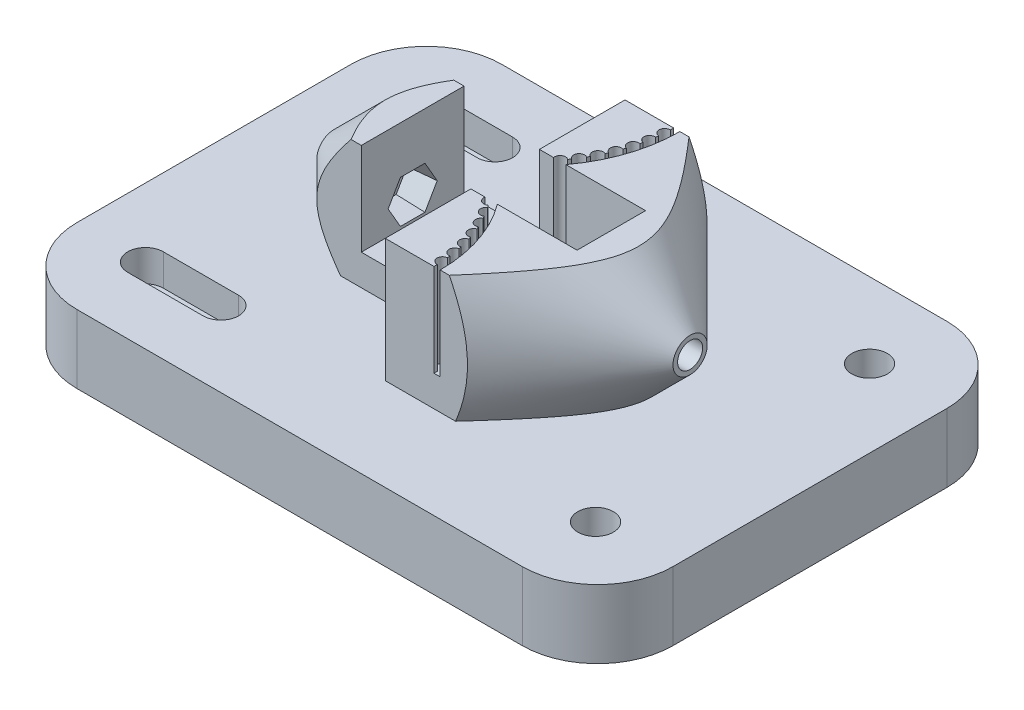
from build123d import *

# Parameters (mm, degrees)
BOSS_EXTRUDE1_DEPTH  = 10
BOSS_EXTRUDE3_DEPTH  = 18
CUT_EXTRUDE1_DEPTH   = 13.5
CUT_EXTRUDE11_DEPTH  = 13.5
SKETCH18_R           = 0.8
CUT_EXTRUDE12_DEPTH  = 13.5
CUT_EXTRUDE5_REACH   = 110.337
SKETCH8_R            = 2.6
SKETCH9_R            = 4.1
CUT_EXTRUDE6_DEPTH   = 5.4
CUT_EXTRUDE7_REACH   = 112.44
SKETCH11_R           = 1.6
CUT_EXTRUDE8_DEPTH   = 3
SKETCH13_W           = 19.1
SKETCH13_H           = 8.2
SKETCH13_W_2         = 8.2
BOSS_EXTRUDE4_DEPTH  = 0.3
CUT_EXTRUDE9_REACH   = 99.254
SKETCH14_R           = 1.825
CUT_EXTRUDE10_DEPTH  = 4
CUT_EXTRUDE10_DRAFT  = -5
MIRROR1_COPY_1_DEPTH = 4
MIRROR1_COPY_1_DRAFT = -5


with BuildPart() as part:
    # Sketch1 → Boss-Extrude1 (new body)
    with BuildSketch(Plane(origin=(0, 0, 0), x_dir=(1, 0, 0), z_dir=(0, 1, 0))):
        with BuildLine():
            Line((0, 11), (0, 51))
            ThreePointArc((0, 51), (3.221825407, 58.778174593), (11, 62))
            Line((11, 62), (76, 62))
            ThreePointArc((76, 62), (83.778174593, 58.778174593), (87, 51))
            Line((87, 51), (87, 11))
            ThreePointArc((87, 11), (83.778174593, 3.221825407), (76, 0))
            Line((76, 0), (11, 0))
            ThreePointArc((11, 0), (3.221825407, 3.221825407), (0, 11))
        make_face()
    extrude(amount=BOSS_EXTRUDE1_DEPTH)


with BuildPart() as body_2:
    # Sketch2 → Boss-Extrude3 (new body)
    with BuildSketch(Plane(origin=(0, 10, 0), x_dir=(1, 0, 0), z_dir=(0, 1, 0))):
        Polygon((17.5, 38.5), (42.5, 38.5), (42.5, 48.5), (57.5, 48.5), (67.5, 38.5), (69.5, 38.5), (69.5, 23.5), (67.5, 23.5), (57.5, 13.5), (42.5, 13.5), (42.5, 23.5), (17.5, 23.5), align=None)
    extrude(amount=BOSS_EXTRUDE3_DEPTH)

    # Sketch3 → Cut-Revolve3 (revolve, cut)
    with BuildSketch(Plane.XY.offset(-31)):
        Polygon((17.5, 20.5), (35.5, 38.5), (17.5, 38.5), align=None)
        Polygon((69.5, 20.5), (51.5, 38.5), (69.5, 38.5), align=None)
    revolve(axis=Axis((17.5, 18, -31), (-1, 0, 0)), mode=Mode.SUBTRACT)

    # Sketch4 → Cut-Extrude1 (cut)
    with BuildSketch(Plane(origin=(0, 28, 0), x_dir=(1, 0, 0), z_dir=(0, 1, 0))):
        Polygon((29, 38.5), (29, 23.5), (42.5, 23.5), (42.5, 26), (58, 26), (58, 36), (42.5, 36), (42.5, 38.5), align=None)
    extrude(amount=-CUT_EXTRUDE1_DEPTH, mode=Mode.SUBTRACT)

    # Sketch17 → Cut-Extrude11 (cut)
    with BuildSketch(Plane(origin=(0, 28, 0), x_dir=(1, 0, 0), z_dir=(0, 1, 0))):
        with BuildLine():
            Line((49.61, 48.5), (50.51, 48.5))
            ThreePointArc((50.51, 48.5), (49.44536539, 41.91454027), (46.359925373, 36))
            Line((46.359925373, 36), (45.222494996, 36))
            ThreePointArc((45.222494996, 36), (48.481273141, 41.876175573), (49.61, 48.5))
        make_face()
        with BuildLine():
            Line((49.61, 13.5), (50.51, 13.5))
            ThreePointArc((50.51, 13.5), (49.44536539, 20.08545973), (46.359925373, 26))
            Line((46.359925373, 26), (45.222494996, 26))
            ThreePointArc((45.222494996, 26), (48.481273141, 20.123824427), (49.61, 13.5))
        make_face()
    extrude(amount=-CUT_EXTRUDE11_DEPTH, mode=Mode.SUBTRACT)

    # Sketch18 → Cut-Extrude12 (cut)
    with BuildSketch(Plane(origin=(0, 28, 0), x_dir=(1, 0, 0), z_dir=(0, 1, 0))):
        with Locations((49.568312365, 14.790646165)):
            Circle(SKETCH18_R)
        with Locations((49.339730182, 16.776850156)):
            Circle(SKETCH18_R)
        with Locations((48.913986037, 18.730308124)):
            Circle(SKETCH18_R)
        with Locations((48.295334452, 20.631498889)):
            Circle(SKETCH18_R)
        with Locations((47.489957699, 22.461423585)):
            Circle(SKETCH18_R)
        with Locations((46.505904021, 24.201795519)):
            Circle(SKETCH18_R)
        with Locations((45.353007203, 25.835222908)):
            Circle(SKETCH18_R)
        with Locations((49.568312365, 47.209353835)):
            Circle(SKETCH18_R)
        with Locations((49.339730182, 45.223149844)):
            Circle(SKETCH18_R)
        with Locations((48.913986037, 43.269691876)):
            Circle(SKETCH18_R)
        with Locations((48.295334452, 41.368501111)):
            Circle(SKETCH18_R)
        with Locations((47.489957699, 39.538576415)):
            Circle(SKETCH18_R)
        with Locations((46.505904021, 37.798204481)):
            Circle(SKETCH18_R)
        with Locations((45.353007203, 36.164777092)):
            Circle(SKETCH18_R)
    extrude(amount=-CUT_EXTRUDE12_DEPTH, mode=Mode.SUBTRACT)


with BuildPart() as part_1:
    add(part.part)

    # Intersect1: read off the stored shape, not the designer's step
    # Intersect1: union body 2
    add(body_2.part)

    # Sketch8 → Cut-Extrude5 (cut, up to next)
    with BuildSketch(Plane(origin=(0, 10, 0), x_dir=(1, 0, 0), z_dir=(0, 1, 0)), mode=Mode.PRIVATE) as cut_extrude5_sk1:
        with Locations(Location((75.7, 51, 0), (0, 0, 270))):
            Circle(SKETCH8_R)
    cut_extrude5_tool1 = extrude(cut_extrude5_sk1.sketch, amount=-CUT_EXTRUDE5_REACH, mode=Mode.PRIVATE) & part_1.part
    # Sketch8 → Cut-Extrude5 (cut, up to next)
    with BuildSketch(Plane(origin=(0, 10, 0), x_dir=(1, 0, 0), z_dir=(0, 1, 0)), mode=Mode.PRIVATE) as cut_extrude5_sk2:
        with Locations(Location((75.7, 11, 0), (0, 0, 270))):
            Circle(SKETCH8_R)
    cut_extrude5_tool2 = extrude(cut_extrude5_sk2.sketch, amount=-CUT_EXTRUDE5_REACH, mode=Mode.PRIVATE) & part_1.part
    # Sketch8 → Cut-Extrude5 (cut, up to next)
    with BuildSketch(Plane(origin=(0, 10, 0), x_dir=(1, 0, 0), z_dir=(0, 1, 0)), mode=Mode.PRIVATE) as cut_extrude5_sk3:
        with BuildLine():
            Line((10, 53.6), (21, 53.6))
            ThreePointArc((21, 53.6), (23.6, 51), (21, 48.4))
            Line((21, 48.4), (10, 48.4))
            ThreePointArc((10, 48.4), (7.4, 51), (10, 53.6))
        make_face()
    cut_extrude5_tool3 = extrude(cut_extrude5_sk3.sketch, amount=-CUT_EXTRUDE5_REACH, mode=Mode.PRIVATE) & part_1.part
    # Sketch8 → Cut-Extrude5 (cut, up to next)
    with BuildSketch(Plane(origin=(0, 10, 0), x_dir=(1, 0, 0), z_dir=(0, 1, 0)), mode=Mode.PRIVATE) as cut_extrude5_sk4:
        with BuildLine():
            Line((10, 13.6), (21, 13.6))
            ThreePointArc((21, 13.6), (23.6, 11), (21, 8.4))
            Line((21, 8.4), (10, 8.4))
            ThreePointArc((10, 8.4), (7.4, 11), (10, 13.6))
        make_face()
    cut_extrude5_tool4 = extrude(cut_extrude5_sk4.sketch, amount=-CUT_EXTRUDE5_REACH, mode=Mode.PRIVATE) & part_1.part
    add(cut_extrude5_tool1.solids().sort_by_distance((75.7, 10, -51))[0], mode=Mode.SUBTRACT)
    add(cut_extrude5_tool2.solids().sort_by_distance((75.7, 10, -11))[0], mode=Mode.SUBTRACT)
    add(cut_extrude5_tool3.solids().sort_by_distance((15.5, 10, -51))[0], mode=Mode.SUBTRACT)
    add(cut_extrude5_tool4.solids().sort_by_distance((15.5, 10, -11))[0], mode=Mode.SUBTRACT)

    # Sketch9 → Cut-Extrude6 (cut)
    with BuildSketch(Plane.XZ):
        with Locations(Location((75.7, -11, 0), (0, 0, 270))):
            Circle(SKETCH9_R)
        with Locations(Location((75.7, -51, 0), (0, 0, 270))):
            Circle(SKETCH9_R)
        with BuildLine():
            Line((10, -6.9), (21, -6.9))
            ThreePointArc((21, -6.9), (25.1, -11), (21, -15.1))
            Line((21, -15.1), (10, -15.1))
            ThreePointArc((10, -15.1), (8.336419524, -14.747332385), (6.95902976, -13.75))
            Line((6.95902976, -13.75), (3, -13.75))
            Line((3, -13.75), (3, -8.25))
            Line((3, -8.25), (6.95902976, -8.25))
            ThreePointArc((6.95902976, -8.25), (8.336419524, -7.252667615), (10, -6.9))
        make_face()
        with BuildLine():
            Line((10, -46.9), (21, -46.9))
            ThreePointArc((21, -46.9), (25.1, -51), (21, -55.1))
            Line((21, -55.1), (10, -55.1))
            ThreePointArc((10, -55.1), (8.336419524, -54.747332385), (6.95902976, -53.75))
            Line((6.95902976, -53.75), (3, -53.75))
            Line((3, -53.75), (3, -48.25))
            Line((3, -48.25), (6.95902976, -48.25))
            ThreePointArc((6.95902976, -48.25), (8.336419524, -47.252667615), (10, -46.9))
        make_face()
    extrude(amount=-CUT_EXTRUDE6_DEPTH, mode=Mode.SUBTRACT)

    # Sketch11 → Cut-Extrude7 (cut, up to next)
    with BuildSketch(Plane.ZY, mode=Mode.PRIVATE) as cut_extrude7_sk1:
        with Locations(Location((-11, 5, 0), (0, 0, 14.477512186))):
            Circle(SKETCH11_R)
    cut_extrude7_tool1 = extrude(cut_extrude7_sk1.sketch, amount=-CUT_EXTRUDE7_REACH, mode=Mode.PRIVATE) & part_1.part
    # Sketch11 → Cut-Extrude7 (cut, up to next)
    with BuildSketch(Plane.ZY, mode=Mode.PRIVATE) as cut_extrude7_sk2:
        with Locations(Location((-51, 5, 0), (0, 0, 14.477512186))):
            Circle(SKETCH11_R)
    cut_extrude7_tool2 = extrude(cut_extrude7_sk2.sketch, amount=-CUT_EXTRUDE7_REACH, mode=Mode.PRIVATE) & part_1.part
    add(cut_extrude7_tool1.solids().sort_by_distance((0, 5, -11))[0], mode=Mode.SUBTRACT)
    add(cut_extrude7_tool2.solids().sort_by_distance((0, 5, -51))[0], mode=Mode.SUBTRACT)

    # Sketch12 → Cut-Extrude8 (cut)
    with BuildSketch(Plane(origin=(3, 0, 0), x_dir=(0, 0, -1), z_dir=(1, 0, 0))):
        Polygon((48.25, 6.58771324), (48.25, 3.41228676), (51, 1.824573519), (53.75, 3.41228676), (53.75, 6.58771324), (51, 8.175426481), align=None)
        Polygon((13.75, 3.41228676), (13.75, 6.58771324), (11, 8.175426481), (8.25, 6.58771324), (8.25, 3.41228676), (11, 1.824573519), align=None)
    extrude(amount=CUT_EXTRUDE8_DEPTH, mode=Mode.SUBTRACT)

    # Sketch13 → Boss-Extrude4 (add)
    with BuildSketch(Plane.XZ.offset(-5.4)):
        with Locations((15.55, -51)):
            Rectangle(SKETCH13_W, SKETCH13_H)
        with Locations((15.55, -11)):
            Rectangle(SKETCH13_W, SKETCH13_H)
        with Locations((75.7, -11)):
            Rectangle(SKETCH13_W_2, SKETCH13_H)
        with Locations((75.7, -51)):
            Rectangle(SKETCH13_W_2, SKETCH13_H)
    extrude(amount=BOSS_EXTRUDE4_DEPTH)

    # Sketch14 → Cut-Extrude9 (cut, up to next)
    with BuildSketch(Plane.ZY.offset(-17.5), mode=Mode.PRIVATE) as cut_extrude9_sk1:
        with Locations((-31, 18)):
            Circle(SKETCH14_R)
    cut_extrude9_tool1 = extrude(cut_extrude9_sk1.sketch, amount=-CUT_EXTRUDE9_REACH, mode=Mode.PRIVATE) & part_1.part
    cut_extrude9 = cut_extrude9_tool1.solids().sort_by_distance((17.5, 18, -31))[0]
    add(cut_extrude9, mode=Mode.SUBTRACT)


with BuildPart() as cut_extrude10_tool:
    # Sketch15 → Cut-Extrude10 (with draft: the straight prism first)
    with BuildSketch(Plane(origin=(29, 0, 0), x_dir=(0, 0, -1), z_dir=(1, 0, 0))):
        Polygon((32.789785834, 14.9), (34.579571669, 18), (32.789785834, 21.1), (29.210214166, 21.1), (27.420428331, 18), (29.210214166, 14.9), align=None)
    extrude(amount=-CUT_EXTRUDE10_DEPTH)
    # Cut-Extrude10: the draft: its side faces are tilted about the plane it starts from
    cut_extrude10_sides = [cut_extrude10_tool.faces().sort_by_distance(p)[0] for p in [
        (27, 16.45, -33.684678752),
        (27, 19.55, -33.684678752),
        (27, 21.1, -31),
        (27, 19.55, -28.315321248),
        (27, 16.45, -28.315321248),
        (27, 14.9, -31),
    ]]
    draft(cut_extrude10_sides, Plane(origin=(29, 0, 0), x_dir=(0, 0, -1), z_dir=(1, 0, 0)), CUT_EXTRUDE10_DRAFT)


with BuildPart() as part_2:
    add(part_1.part)

    # Cut-Extrude10: cut by cut_extrude10_tool
    add(cut_extrude10_tool.part, mode=Mode.SUBTRACT)

    # Mirror1: Cut-Extrude9 across plane
    add(cut_extrude9.mirror(Plane(origin=(43.5, 0, 0), x_dir=(0, 0, 1), z_dir=(1, 0, 0))), mode=Mode.SUBTRACT)


with BuildPart() as mirror1_copy_1_tool:
    # Mirror1 copy 1 sketch → Mirror1 copy 1 (with draft: the straight prism first)
    with BuildSketch(Plane(origin=(58, 0, 0), x_dir=(0, 0, -1), z_dir=(-1, 0, 0))):
        Polygon((32.789785834, -14.9), (34.579571669, -18), (32.789785834, -21.1), (29.210214166, -21.1), (27.420428331, -18), (29.210214166, -14.9), align=None)
    extrude(amount=-MIRROR1_COPY_1_DEPTH)
    # Mirror1 copy 1: the draft: its side faces are tilted about the plane it starts from
    mirror1_copy_1_sides = [mirror1_copy_1_tool.faces().sort_by_distance(p)[0] for p in [
        (60, 16.45, -33.684678752),
        (60, 19.55, -33.684678752),
        (60, 21.1, -31),
        (60, 19.55, -28.315321248),
        (60, 16.45, -28.315321248),
        (60, 14.9, -31),
    ]]
    draft(mirror1_copy_1_sides, Plane(origin=(58, 0, 0), x_dir=(0, 0, -1), z_dir=(-1, 0, 0)), MIRROR1_COPY_1_DRAFT)


with BuildPart() as part_3:
    add(part_2.part)

    # Mirror1 copy 1: cut by mirror1_copy_1_tool
    add(mirror1_copy_1_tool.part, mode=Mode.SUBTRACT)


solid = part_3.part
